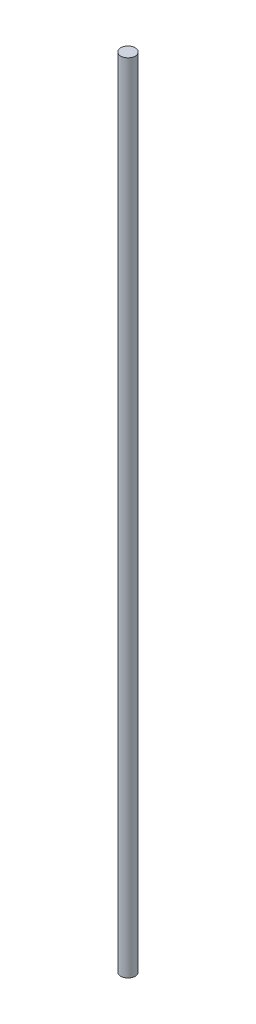
from build123d import *

# Parameters (mm, degrees)
SKETCH1_R           = 2.5
BOSS_EXTRUDE1_DEPTH = 275


with BuildPart() as part:
    # Sketch1 → Boss-Extrude1 (new body)
    with BuildSketch(Plane(origin=(0, 0, 0), x_dir=(1, 0, 0), z_dir=(0, 1, 0))):
        Circle(SKETCH1_R)
    extrude(amount=BOSS_EXTRUDE1_DEPTH)


solid = part.part
